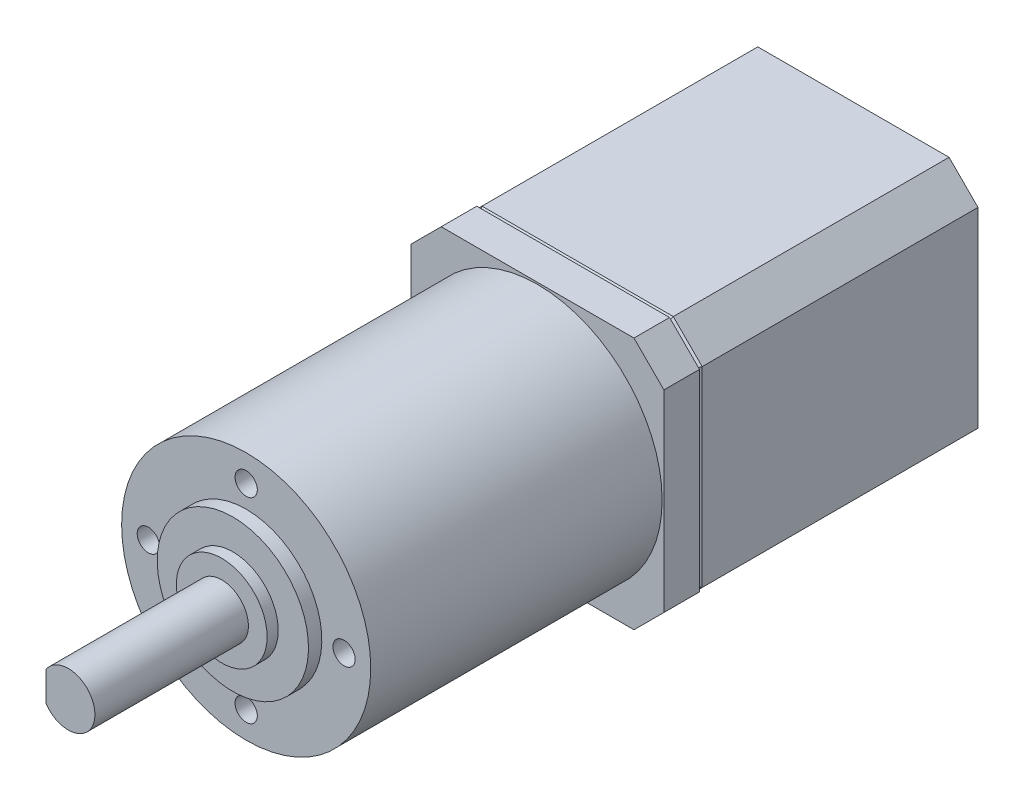
from build123d import *

# Parameters (mm, degrees)
BOSS_EXTRUDE1_DEPTH            = 31.5
BOSS_EXTRUDE2_DEPTH            = 4
CHAMFER1_SIZE                  = 0.5
M3X0_5_TAPPED_HOLE1_AT_2_COUNT = 2
M3X0_5_TAPPED_HOLE1_AT_2_PITCH = 15.556349186
M3X0_5_TAPPED_HOLE1_AT_3_COUNT = 2
M3X0_5_TAPPED_HOLE1_AT_3_PITCH = 22
M3X0_5_TAPPED_HOLE1_AT_4_COUNT = 2
M3X0_5_TAPPED_HOLE1_AT_4_PITCH = 15.556349186
SKETCH8_R                      = 5.1
SKETCH8_R_2                    = 3
BOSS_EXTRUDE3_DEPTH            = 1.25
CUT_EXTRUDE1_DEPTH             = 15
MOVE_START                     = 31.5
MOVE_FACE1_DEPTH               = 4


# Read off the part's stored shape, not the designer's step: Move Face1
with BuildPart() as part:
    # Sketch1 → Boss-Extrude1 (new body)
    with BuildSketch(Plane.XY):
        Polygon((10.75, -14), (-10.75, -14), (-14, -10.75), (-14, 10.75), (-10.75, 14), (10.75, 14), (14, 10.75), (14, -10.75), align=None)
    extrude(amount=BOSS_EXTRUDE1_DEPTH)

    # Chamfer1
    chamfer1_edges = [part.edges().sort_by_distance(p)[0] for p in [
        (-12.375, 12.375, 31.5),
        (-14, 0, 31.5),
        (-12.375, -12.375, 31.5),
        (0, -14, 31.5),
        (12.375, -12.375, 31.5),
        (14, 0, 31.5),
        (12.375, 12.375, 31.5),
        (0, 14, 31.5),
    ]]
    chamfer(chamfer1_edges, length=CHAMFER1_SIZE)


with BuildPart() as body_2:
    # Sketch3 → Boss-Extrude2 (new body)
    with BuildSketch(Plane.XY.offset(31.5)):
        Polygon((14, 10.75), (10.75, 14), (-10.75, 14), (-14, 10.75), (-14, -10.75), (-10.75, -14), (10.75, -14), (14, -10.75), align=None)
    extrude(amount=BOSS_EXTRUDE2_DEPTH)

    # Sketch4 → Revolve1 (revolve)
    with BuildSketch(Plane(origin=(0, 0, 0), x_dir=(0, 0, -1), z_dir=(1, 0, 0))):
        Polygon((-88.25, 0), (-88.25, 3), (-69.75, 3), (-69.75, 8.5), (-68.25, 8.5), (-68.25, 14), (-35.5, 14), (-35.5, 0), align=None)
    revolve(axis=Axis((0, 0, 35.5), (0, 0, 1)))

    # Sketch7 → M3x0.5 Tapped Hole1 (revolve, cut)
    with BuildSketch(Plane(origin=(0, 11, 68.25), x_dir=(0, -1, 0), z_dir=(1, 0, 0))):
        Polygon((0, 0), (0, 5.751075774), (1.25, 5), (1.25, 0), align=None)
    m3x0_5_tapped_hole1 = revolve(axis=Axis((0, 11, 74.6), (0, 0, -1)), mode=Mode.SUBTRACT)

    # M3x0.5 Tapped Hole1 at 2: M3x0.5 Tapped Hole1 ×2
    with Locations(*[Vector(0.7071067811865472, -0.7071067811865478, 0) * (i * M3X0_5_TAPPED_HOLE1_AT_2_PITCH) for i in range(1, M3X0_5_TAPPED_HOLE1_AT_2_COUNT)]):
        add(m3x0_5_tapped_hole1, mode=Mode.SUBTRACT)

    # M3x0.5 Tapped Hole1 at 3: M3x0.5 Tapped Hole1 ×2
    with Locations(*[(0, -i * M3X0_5_TAPPED_HOLE1_AT_3_PITCH, 0) for i in range(1, M3X0_5_TAPPED_HOLE1_AT_3_COUNT)]):
        add(m3x0_5_tapped_hole1, mode=Mode.SUBTRACT)

    # M3x0.5 Tapped Hole1 at 4: M3x0.5 Tapped Hole1 ×2
    with Locations(*[Vector(-0.7071067811865472, -0.7071067811865478, 0) * (i * M3X0_5_TAPPED_HOLE1_AT_4_PITCH) for i in range(1, M3X0_5_TAPPED_HOLE1_AT_4_COUNT)]):
        add(m3x0_5_tapped_hole1, mode=Mode.SUBTRACT)

    # Sketch8 → Boss-Extrude3 (add)
    with BuildSketch(Plane.XY.offset(69.75)):
        Circle(SKETCH8_R)
        with Locations(Location((0, 0, 0), (0, 0, 90))):
            Circle(SKETCH8_R_2, mode=Mode.SUBTRACT)
    extrude(amount=BOSS_EXTRUDE3_DEPTH)

    # Sketch9 → Cut-Extrude1 (cut)
    with BuildSketch(Plane.XY.offset(88.25)):
        with BuildLine():
            Line((-2.5, 1.658312395), (-2.5, -1.658312395))
            ThreePointArc((-2.5, -1.658312395), (-3, 0), (-2.5, 1.658312395))
        make_face()
    extrude(amount=-CUT_EXTRUDE1_DEPTH, mode=Mode.SUBTRACT)

    # Move Face1 outline → Move Face1 (add)
    with BuildSketch(Plane.XY.offset(MOVE_START)):
        Polygon((14.2, -10.832842712), (14.2, 10.832842712), (10.832842712, 14.2), (-10.832842712, 14.2), (-14.2, 10.832842712), (-14.2, -10.832842712), (-10.832842712, -14.2), (10.832842712, -14.2), align=None)
        Polygon((10.75, 14), (14, 10.75), (14, -10.75), (10.75, -14), (-10.75, -14), (-14, -10.75), (-14, 10.75), (-10.75, 14), align=None, mode=Mode.SUBTRACT)
    extrude(amount=MOVE_FACE1_DEPTH)


solid = Compound([part.part, body_2.part])
